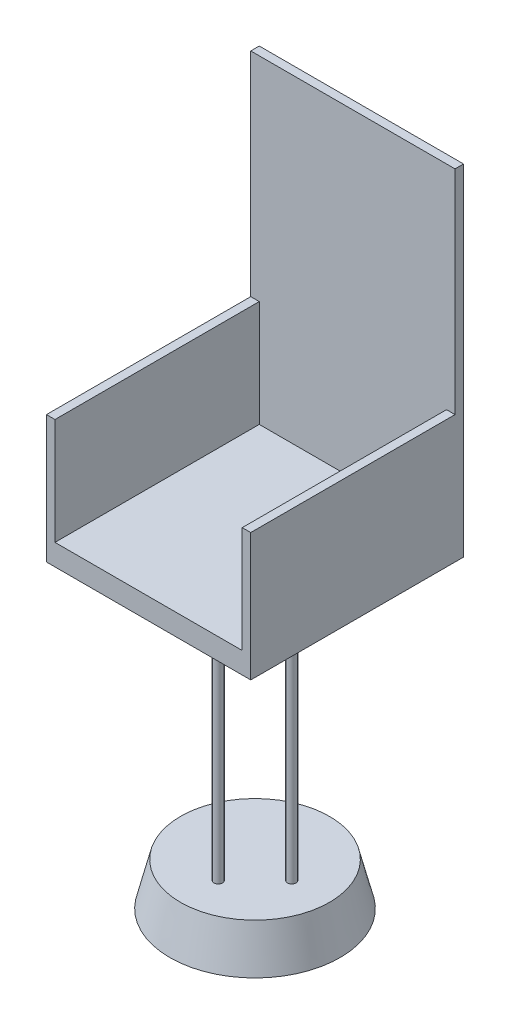
from build123d import *

# Parameters (mm, degrees)
SKETCH1_R            = 200
BOSS_EXTRUDE1_DEPTH  = 100
BOSS_EXTRUDE1_TAPER  = 14
SKETCH2_R            = 10
BOSS_EXTRUDE2_DEPTH  = 610
SKETCH7_W            = 480
SKETCH7_H            = 500
BOSS_EXTRUDE8_DEPTH  = 50
SKETCH8_W            = 480
SKETCH8_H            = 20
BOSS_EXTRUDE9_DEPTH  = 750
SKETCH9_W            = 20
SKETCH9_H            = 480
BOSS_EXTRUDE10_DEPTH = 250


with BuildPart() as part:
    # Sketch1 → Boss-Extrude1 (new body)
    with BuildSketch(Plane(origin=(0, 0, 0), x_dir=(1, 0, 0), z_dir=(0, 1, 0))):
        Circle(SKETCH1_R)
    extrude(amount=BOSS_EXTRUDE1_DEPTH, taper=BOSS_EXTRUDE1_TAPER)

    # Sketch2 → Boss-Extrude2 (add)
    with BuildSketch(Plane(origin=(0, 100, 0), x_dir=(1, 0, 0), z_dir=(0, 1, 0))):
        with Locations((86.344755042, 0)):
            Circle(SKETCH2_R)
        with Locations((0, -86.344755042)):
            Circle(SKETCH2_R)
        with Locations((-86.344755042, 0)):
            Circle(SKETCH2_R)
        with Locations((0, 86.344755042)):
            Circle(SKETCH2_R)
    extrude(amount=BOSS_EXTRUDE2_DEPTH)

    # Sketch7 → Boss-Extrude8 (add)
    with BuildSketch(Plane(origin=(0, 710, 0), x_dir=(1, 0, 0), z_dir=(0, 1, 0))):
        Rectangle(SKETCH7_W, SKETCH7_H)
    extrude(amount=BOSS_EXTRUDE8_DEPTH)

    # Sketch8 → Boss-Extrude9 (add)
    with BuildSketch(Plane(origin=(0, 760, 0), x_dir=(1, 0, 0), z_dir=(0, 1, 0))):
        with Locations((0, 240)):
            Rectangle(SKETCH8_W, SKETCH8_H)
    extrude(amount=BOSS_EXTRUDE9_DEPTH)

    # Sketch9 → Boss-Extrude10 (add)
    with BuildSketch(Plane(origin=(0, 760, 0), x_dir=(1, 0, 0), z_dir=(0, 1, 0))):
        with Locations((-230, -10)):
            Rectangle(SKETCH9_W, SKETCH9_H)
        with Locations((230, -10)):
            Rectangle(SKETCH9_W, SKETCH9_H)
    extrude(amount=BOSS_EXTRUDE10_DEPTH)


solid = part.part
